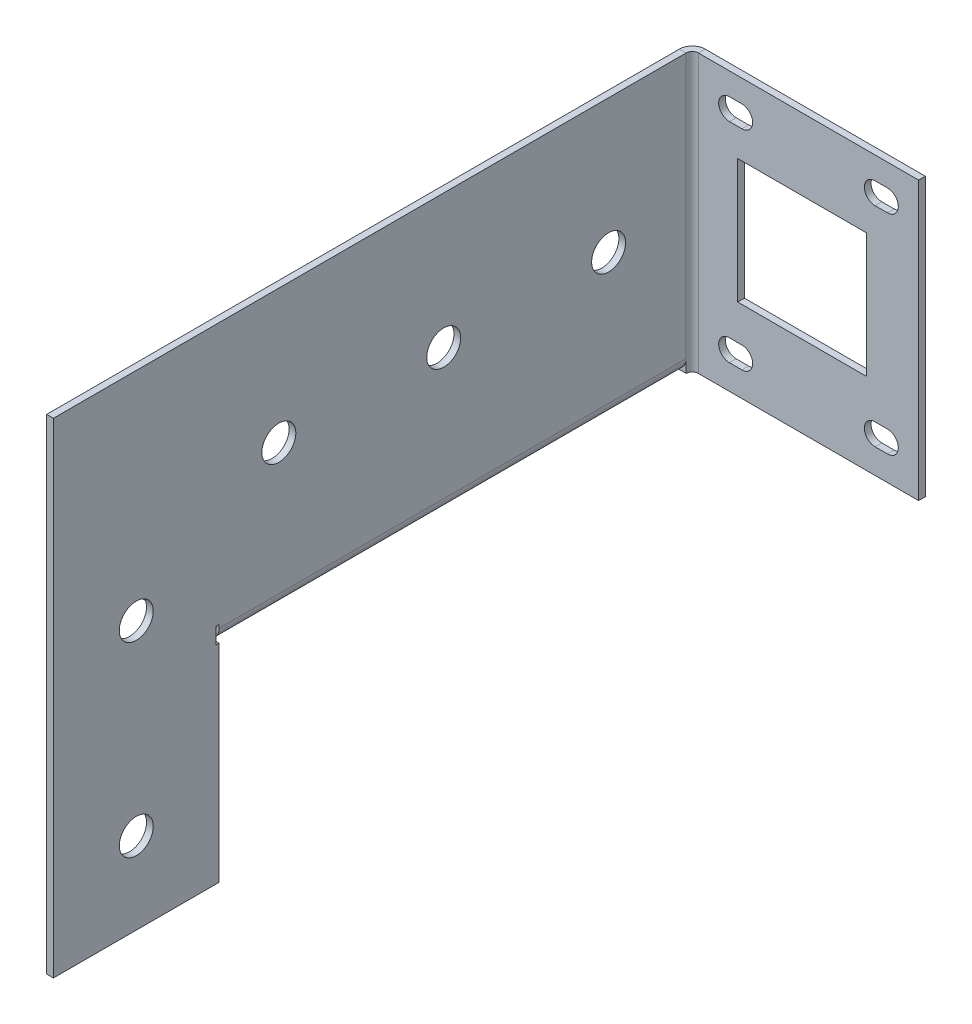
from build123d import *

# Parameters (mm, degrees)
SKETCH1_W                    = 28.1256
SKETCH1_H                    = 33.5
SKETCH1_W_2                  = 15.5256
SKETCH1_H_2                  = 15
BASE_FLANGE2_DEPTH           = 0.8128
EDGE_FLANGE3_STRIP_W         = 4.7244
EDGE_FLANGE3_STRIP_H         = 0.8128
EDGE_FLANGE3_STRIP_CUT_DEPTH = 33.5
EDGE_FLANGE3_DEPTH           = 33.5
EDGE_FLANGE3_FLAT_DEPTH      = 0.8128
EDGE_FLANGE4_START           = 0.7366
EDGE_FLANGE4_DEPTH           = 56.7698
EDGE_FLANGE4_START_2         = 57.1
EDGE_FLANGE4_2_DEPTH         = 0.4064
EDGE_FLANGE4_3_DEPTH         = 56.3634
CUT_EXTRUDE1_REACH           = 94.079
SKETCH22_R                   = 2.05
CUT_EXTRUDE2_REACH           = 89.705
SKETCH23_W                   = 11.2634
SKETCH23_H                   = 10
CUT_EXTRUDE3_REACH           = 93.47


# Read off the part's stored shape, not the designer's step: Edge-Flange4
# Sheet-metal steps are written as plain solids
with BuildPart() as part:
    # Sketch1 → Base-Flange2 (new body)
    with BuildSketch(Plane.XY):
        Rectangle(SKETCH1_W, SKETCH1_H)
        with Locations((0, 0.59)):
            Rectangle(SKETCH1_W_2, SKETCH1_H_2, mode=Mode.SUBTRACT)
    extrude(amount=-BASE_FLANGE2_DEPTH)

    # Edge-Flange3 strip (across the edge) → Edge-Flange3 strip cut (cut)
    with BuildSketch(Plane(origin=(-14.0628, 16.75, 0), x_dir=(1, 0, 0), z_dir=(0, -1, 0))):
        with Locations((-0.8128, -0.4064)):
            Rectangle(EDGE_FLANGE3_STRIP_W, EDGE_FLANGE3_STRIP_H)
    extrude(amount=EDGE_FLANGE3_STRIP_CUT_DEPTH, mode=Mode.SUBTRACT)

    # Edge-Flange3 bend section (across the edge) → Edge-Flange3 (add)
    with BuildSketch(Plane(origin=(-14.0628, 16.75, 0), x_dir=(1, 0, 0), z_dir=(0, -1, 0))):
        with BuildLine():
            Line((0, 0.7366), (0.8128, 0.7366))
            ThreePointArc((0.8128, 0.7366), (1.028545145, 0.215745145), (1.5494, 0))
            Line((1.5494, 0), (1.5494, -0.8128))
            ThreePointArc((1.5494, -0.8128), (0.453808753, -0.358991247), (0, 0.7366))
        make_face()
    extrude(amount=EDGE_FLANGE3_DEPTH)

    # Edge-Flange3 profile (on flange) → Edge-Flange3 flat (add)
    with BuildSketch(Plane(origin=(-14.0628, 0, 0), x_dir=(0, -1, 0), z_dir=(-1, 0, 0))):
        Polygon((-16.75, 0.7366), (16.75, 0.7366), (16.75, 57.1), (41.75, 57.1), (41.75, 77.1), (-16.75, 77.1), align=None)
    extrude(amount=-EDGE_FLANGE3_FLAT_DEPTH)

    # Edge-Flange4 outline → Edge-Flange4 (cut)
    with BuildSketch(Plane.XY.offset(EDGE_FLANGE4_START)):
        with BuildLine():
            ThreePointArc((-13.25, -15.2006), (-13.468624211, -15.994121367), (-14.0628, -16.563707039))
            Line((-14.0628, -16.563707039), (-14.0628, -16.75))
            Line((-14.0628, -16.75), (-13.25, -16.75))
            Line((-13.25, -16.75), (-13.25, -15.2006))
        make_face()
    extrude(amount=EDGE_FLANGE4_DEPTH, mode=Mode.SUBTRACT)

    # Edge-Flange4 2 outline → Edge-Flange4 2 (cut)
    with BuildSketch(Plane.XY.offset(EDGE_FLANGE4_START_2)):
        with BuildLine():
            Line((-14.0628, -14.7942), (-14.0628, -16.563707039))
            ThreePointArc((-14.0628, -16.563707039), (-13.468624211, -15.994121367), (-13.25, -15.2006))
            Line((-13.25, -15.2006), (-13.25, -14.7942))
            Line((-13.25, -14.7942), (-14.0628, -14.7942))
        make_face()
    extrude(amount=EDGE_FLANGE4_2_DEPTH, mode=Mode.SUBTRACT)

    # Edge-Flange4 3 outline → Edge-Flange4 3 (add)
    with BuildSketch(Plane.XY.offset(EDGE_FLANGE4_START)):
        with BuildLine():
            Line((-26.0628, -16.75), (-14.7994, -16.75))
            ThreePointArc((-14.7994, -16.75), (-14.419503755, -16.702704924), (-14.0628, -16.563707039))
            Line((-14.0628, -16.563707039), (-14.0628, -15.2006))
            ThreePointArc((-14.0628, -15.2006), (-14.278545145, -15.721454855), (-14.7994, -15.9372))
            Line((-14.7994, -15.9372), (-26.0628, -15.9372))
            Line((-26.0628, -15.9372), (-26.0628, -16.75))
        make_face()
    extrude(amount=EDGE_FLANGE4_3_DEPTH)

    # Sketch22 → Cut-Extrude1 (cut, up to next)
    with BuildSketch(Plane.ZY.offset(14.0628), mode=Mode.PRIVATE) as cut_extrude1_sk1:
        with Locations((67.1, -31.91)):
            Circle(SKETCH22_R)
    cut_extrude1_tool1 = extrude(cut_extrude1_sk1.sketch, amount=-CUT_EXTRUDE1_REACH, mode=Mode.PRIVATE) & part.part
    # Sketch22 → Cut-Extrude1 (cut, up to next)
    with BuildSketch(Plane.ZY.offset(14.0628), mode=Mode.PRIVATE) as cut_extrude1_sk2:
        with Locations((67.1, -9.41)):
            Circle(SKETCH22_R)
    cut_extrude1_tool2 = extrude(cut_extrude1_sk2.sketch, amount=-CUT_EXTRUDE1_REACH, mode=Mode.PRIVATE) & part.part
    # Sketch22 → Cut-Extrude1 (cut, up to next)
    with BuildSketch(Plane.ZY.offset(14.0628), mode=Mode.PRIVATE) as cut_extrude1_sk3:
        with Locations((49.895058849, 0.59)):
            Circle(SKETCH22_R)
    cut_extrude1_tool3 = extrude(cut_extrude1_sk3.sketch, amount=-CUT_EXTRUDE1_REACH, mode=Mode.PRIVATE) & part.part
    # Sketch22 → Cut-Extrude1 (cut, up to next)
    with BuildSketch(Plane.ZY.offset(14.0628), mode=Mode.PRIVATE) as cut_extrude1_sk4:
        with Locations((29.995058849, 0.59)):
            Circle(SKETCH22_R)
    cut_extrude1_tool4 = extrude(cut_extrude1_sk4.sketch, amount=-CUT_EXTRUDE1_REACH, mode=Mode.PRIVATE) & part.part
    # Sketch22 → Cut-Extrude1 (cut, up to next)
    with BuildSketch(Plane.ZY.offset(14.0628), mode=Mode.PRIVATE) as cut_extrude1_sk5:
        with Locations((10.095058849, 0.59)):
            Circle(SKETCH22_R)
    cut_extrude1_tool5 = extrude(cut_extrude1_sk5.sketch, amount=-CUT_EXTRUDE1_REACH, mode=Mode.PRIVATE) & part.part
    add(cut_extrude1_tool1.solids().sort_by_distance((-14.0628, -31.91, 67.1))[0], mode=Mode.SUBTRACT)
    add(cut_extrude1_tool2.solids().sort_by_distance((-14.0628, -9.41, 67.1))[0], mode=Mode.SUBTRACT)
    add(cut_extrude1_tool3.solids().sort_by_distance((-14.0628, 0.59, 49.895059))[0], mode=Mode.SUBTRACT)
    add(cut_extrude1_tool4.solids().sort_by_distance((-14.0628, 0.59, 29.995059))[0], mode=Mode.SUBTRACT)
    add(cut_extrude1_tool5.solids().sort_by_distance((-14.0628, 0.59, 10.095059))[0], mode=Mode.SUBTRACT)

    # Sketch23 → Cut-Extrude2 (cut, up to next)
    with BuildSketch(Plane(origin=(0, -15.9372, 0), x_dir=(1, 0, 0), z_dir=(0, 1, 0)), mode=Mode.PRIVATE) as cut_extrude2_sk1:
        with Locations((-20.4311, -29.2366)):
            Rectangle(SKETCH23_W, SKETCH23_H)
    cut_extrude2_tool1 = extrude(cut_extrude2_sk1.sketch, amount=-CUT_EXTRUDE2_REACH, mode=Mode.PRIVATE) & part.part
    # Sketch23 → Cut-Extrude2 (cut, up to next)
    with BuildSketch(Plane(origin=(0, -15.9372, 0), x_dir=(1, 0, 0), z_dir=(0, 1, 0)), mode=Mode.PRIVATE) as cut_extrude2_sk2:
        with BuildLine():
            Line((-22.8128, -18.4866), (-22.8128, -10.4866))
            ThreePointArc((-22.8128, -10.4866), (-20.0628, -7.7366), (-17.3128, -10.4866))
            Line((-17.3128, -10.4866), (-17.3128, -18.4866))
            ThreePointArc((-17.3128, -18.4866), (-20.0628, -21.2366), (-22.8128, -18.4866))
        make_face()
    cut_extrude2_tool2 = extrude(cut_extrude2_sk2.sketch, amount=-CUT_EXTRUDE2_REACH, mode=Mode.PRIVATE) & part.part
    # Sketch23 → Cut-Extrude2 (cut, up to next)
    with BuildSketch(Plane(origin=(0, -15.9372, 0), x_dir=(1, 0, 0), z_dir=(0, 1, 0)), mode=Mode.PRIVATE) as cut_extrude2_sk3:
        with BuildLine():
            Line((-22.8128, -39.9866), (-22.8128, -47.9866))
            ThreePointArc((-22.8128, -47.9866), (-20.0628, -50.7366), (-17.3128, -47.9866))
            Line((-17.3128, -47.9866), (-17.3128, -39.9866))
            ThreePointArc((-17.3128, -39.9866), (-20.0628, -37.2366), (-22.8128, -39.9866))
        make_face()
    cut_extrude2_tool3 = extrude(cut_extrude2_sk3.sketch, amount=-CUT_EXTRUDE2_REACH, mode=Mode.PRIVATE) & part.part
    add(cut_extrude2_tool1.solids().sort_by_distance((-20.4311, -15.9372, 29.2366))[0], mode=Mode.SUBTRACT)
    add(cut_extrude2_tool2.solids().sort_by_distance((-20.0628, -15.9372, 14.4866))[0], mode=Mode.SUBTRACT)
    add(cut_extrude2_tool3.solids().sort_by_distance((-20.0628, -15.9372, 43.9866))[0], mode=Mode.SUBTRACT)

    # Sketch26 → Cut-Extrude3 (cut, up to next)
    with BuildSketch(Plane.XY, mode=Mode.PRIVATE) as cut_extrude3_sk1:
        with BuildLine():
            Line((8.8128, -13.75), (10.3128, -13.75))
            ThreePointArc((10.3128, -13.75), (11.6128, -12.45), (10.3128, -11.15))
            Line((10.3128, -11.15), (8.8128, -11.15))
            ThreePointArc((8.8128, -11.15), (7.5128, -12.45), (8.8128, -13.75))
        make_face()
    cut_extrude3_tool1 = extrude(cut_extrude3_sk1.sketch, amount=-CUT_EXTRUDE3_REACH, mode=Mode.PRIVATE) & part.part
    # Sketch26 → Cut-Extrude3 (cut, up to next)
    with BuildSketch(Plane.XY, mode=Mode.PRIVATE) as cut_extrude3_sk2:
        with BuildLine():
            Line((-8.7634, -13.75), (-7.2634, -13.75))
            ThreePointArc((-7.2634, -13.75), (-5.9634, -12.45), (-7.2634, -11.15))
            Line((-7.2634, -11.15), (-8.7634, -11.15))
            ThreePointArc((-8.7634, -11.15), (-10.0634, -12.45), (-8.7634, -13.75))
        make_face()
    cut_extrude3_tool2 = extrude(cut_extrude3_sk2.sketch, amount=-CUT_EXTRUDE3_REACH, mode=Mode.PRIVATE) & part.part
    # Sketch26 → Cut-Extrude3 (cut, up to next)
    with BuildSketch(Plane.XY, mode=Mode.PRIVATE) as cut_extrude3_sk3:
        with BuildLine():
            Line((8.8128, 11.45), (10.3128, 11.45))
            ThreePointArc((10.3128, 11.45), (11.6128, 12.75), (10.3128, 14.05))
            Line((10.3128, 14.05), (8.8128, 14.05))
            ThreePointArc((8.8128, 14.05), (7.5128, 12.75), (8.8128, 11.45))
        make_face()
    cut_extrude3_tool3 = extrude(cut_extrude3_sk3.sketch, amount=-CUT_EXTRUDE3_REACH, mode=Mode.PRIVATE) & part.part
    # Sketch26 → Cut-Extrude3 (cut, up to next)
    with BuildSketch(Plane.XY, mode=Mode.PRIVATE) as cut_extrude3_sk4:
        with BuildLine():
            Line((-8.7634, 11.45), (-7.2634, 11.45))
            ThreePointArc((-7.2634, 11.45), (-5.9634, 12.75), (-7.2634, 14.05))
            Line((-7.2634, 14.05), (-8.7634, 14.05))
            ThreePointArc((-8.7634, 14.05), (-10.0634, 12.75), (-8.7634, 11.45))
        make_face()
    cut_extrude3_tool4 = extrude(cut_extrude3_sk4.sketch, amount=-CUT_EXTRUDE3_REACH, mode=Mode.PRIVATE) & part.part
    add(cut_extrude3_tool1.solids().sort_by_distance((9.5628, -12.45, 0))[0], mode=Mode.SUBTRACT)
    add(cut_extrude3_tool2.solids().sort_by_distance((-8.0134, -12.45, 0))[0], mode=Mode.SUBTRACT)
    add(cut_extrude3_tool3.solids().sort_by_distance((9.5628, 12.75, 0))[0], mode=Mode.SUBTRACT)
    add(cut_extrude3_tool4.solids().sort_by_distance((-8.0134, 12.75, 0))[0], mode=Mode.SUBTRACT)


solid = part.part
